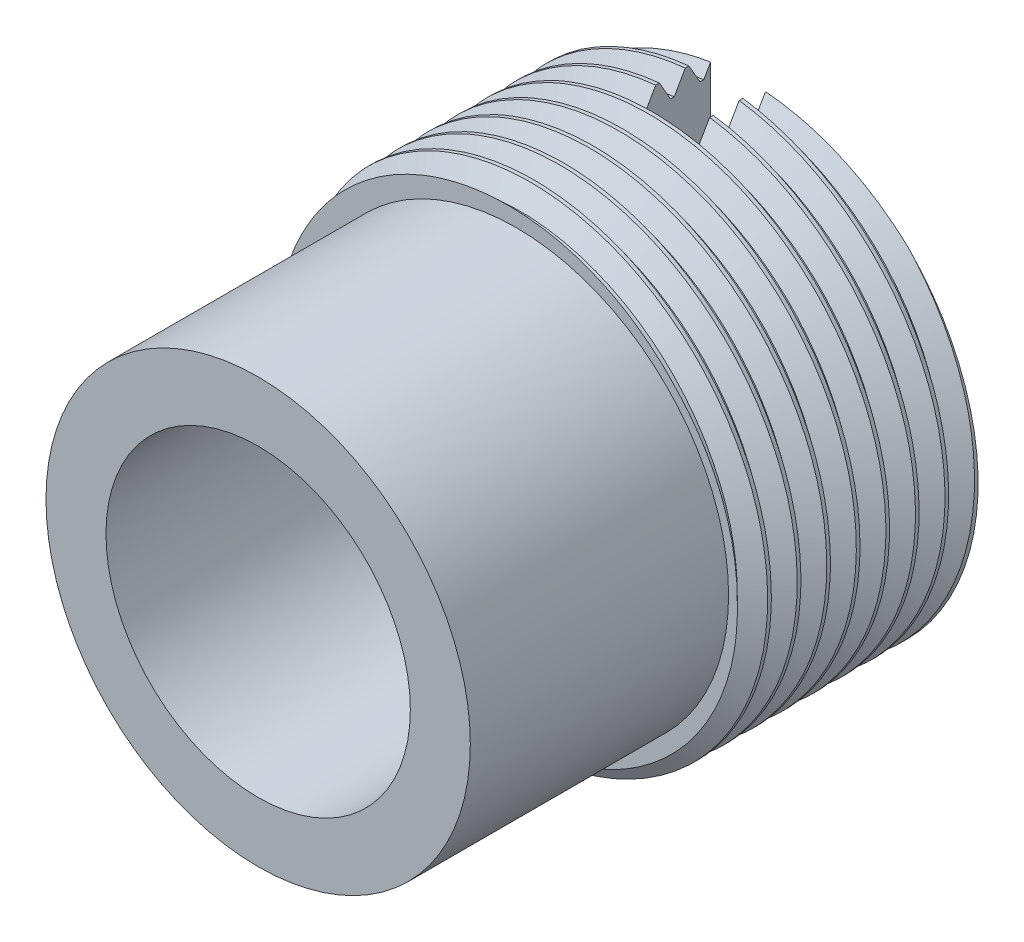
from build123d import *

# Parameters (mm, degrees)
SKETCH1_R           = 10.31875
SKETCH1_R_2         = 6.5405
BOSS_EXTRUDE1_DEPTH = 10.795
THREAD6_PITCH       = 1.27
CUT_EXTRUDE1_START  = -1.27
SKETCH39_R          = 10.31875
CUT_EXTRUDE1_DEPTH  = 1.27
SKETCH41_R          = 9.1186
SKETCH41_R_2        = 6.5405
BOSS_EXTRUDE2_DEPTH = 11.0998
SKETCH42_W          = 2.3622
SKETCH42_H          = 23.84650573
CUT_EXTRUDE2_DEPTH  = 3.175


with BuildPart() as part:
    # Sketch1 → Boss-Extrude1 (new body)
    with BuildSketch(Plane.XY):
        Circle(SKETCH1_R)
        Circle(SKETCH1_R_2, mode=Mode.SUBTRACT)
    extrude(amount=BOSS_EXTRUDE1_DEPTH)

    # Thread6: the profile of Thread Profile11 profile screwed along a left-hand helix of 8 turns, 8 arcs to a turn; built about Z, then put on its axis
    thread6_z = Axis((0, 0, 0), (0, 0, 1))
    thread6_corners = [(10.31905, 0, -0.000173205), (10.31905, 0, 1.1133985), (9.49325, 0, 0.636622647), (9.49325, 0, 0.476602647)]
    with BuildLine(mode=Mode.PRIVATE) as thread6_profile:
        Line(thread6_corners[0], thread6_corners[1])
        Line(thread6_corners[1], thread6_corners[2])
        Line(thread6_corners[2], thread6_corners[3])
        Line(thread6_corners[3], thread6_corners[0])
    thread6_cap = Face(thread6_profile.wire())
    thread6_turn_angles = [0, -22.5, -45, -67.5, -90, -112.5, -135, -157.5, -180, -202.5, -225, -247.5, -270, -292.5, -315, -337.5, -360]
    thread6_turn_weights = [1, 0.9238795325112867, 1, 0.9238795325112867, 1, 0.9238795325112867, 1, 0.9238795325112867, 1, 0.9238795325112867, 1, 0.9238795325112867, 1, 0.9238795325112867, 1, 0.9238795325112867, 1]
    thread6_turn_rails = [Edge.make_bspline([Vector(p[0], p[1], 0).rotate(thread6_z, thread6_turn_angles[k]) / thread6_turn_weights[k] + Vector(0, 0, p[2] + -THREAD6_PITCH * thread6_turn_angles[k] / 360) for k in range(17)], [0, 0, 0, 1, 1, 2, 2, 3, 3, 4, 4, 5, 5, 6, 6, 7, 7, 8, 8, 8], 2, thread6_turn_weights) for p in thread6_corners]
    thread6_turn_sides = [Face.make_surface_from_curves(thread6_turn_rails[p[0]], thread6_turn_rails[p[1]]) for p in [(0, 1), (1, 2), (2, 3), (3, 0)]]
    thread6 = Plane(origin=(0, 0, 10.795), x_dir=(-1, 0, 0), z_dir=(0, 0, -1)) * Solid(Shell([*[p.moved(Location((0, 0, THREAD6_PITCH * i))) for i in range(8) for p in thread6_turn_sides], thread6_cap, thread6_cap.rotate(thread6_z, -2880).moved(Location((0, 0, -THREAD6_PITCH * -2880 / 360)))]))
    add(thread6, mode=Mode.SUBTRACT)

    # Sketch39 → Cut-Extrude1 (cut)
    with BuildSketch(Plane.XY.offset(10.795).offset(CUT_EXTRUDE1_START)):
        Circle(SKETCH39_R)
    extrude(amount=CUT_EXTRUDE1_DEPTH, mode=Mode.SUBTRACT)

    # Sketch41 → Boss-Extrude2 (add)
    with BuildSketch(Plane.XY.offset(9.525)):
        Circle(SKETCH41_R)
        Circle(SKETCH41_R_2, mode=Mode.SUBTRACT)
    extrude(amount=BOSS_EXTRUDE2_DEPTH)

    # Sketch42 → Cut-Extrude2 (cut)
    with BuildSketch(Plane(origin=(0, 0, 0), x_dir=(-1, 0, 0), z_dir=(0, 0, -1))):
        Rectangle(SKETCH42_W, SKETCH42_H)
    extrude(amount=-CUT_EXTRUDE2_DEPTH, mode=Mode.SUBTRACT)


solid = part.part
